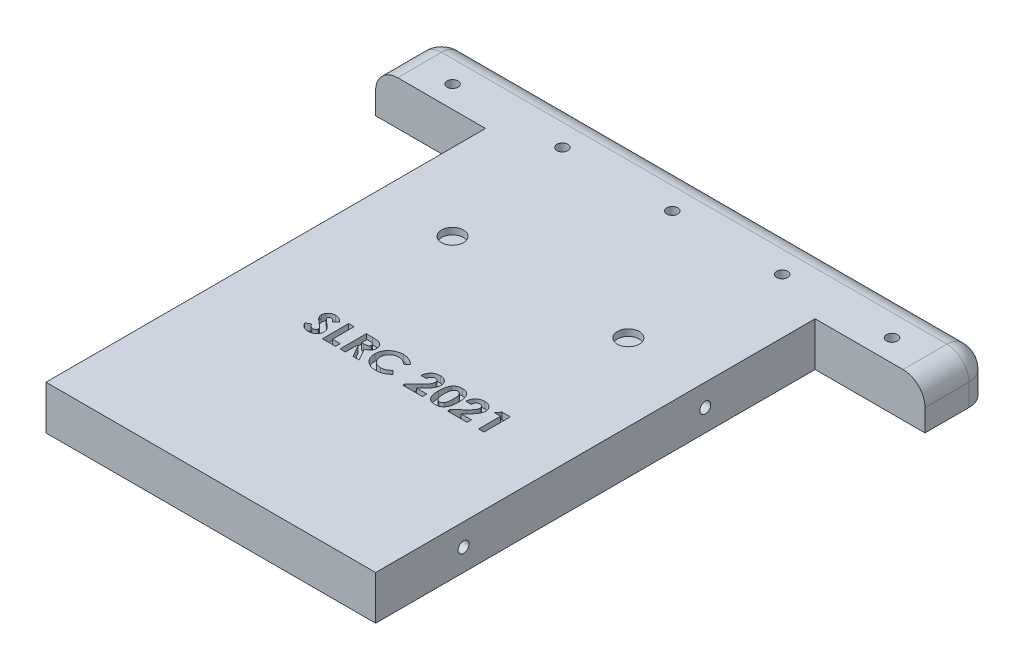
from build123d import *

# Parameters (mm, degrees)
BOSS_EXTRUDE1_DEPTH = 20
SKETCH2_R           = 2.5
CUT_EXTRUDE1_DEPTH  = 240.374184072
SKETCH4_R           = 2.5
CUT_EXTRUDE2_DEPTH  = 5
FILLET1_R           = 10
FILLET2_R           = 10
SKETCH6_R           = 2.5
CUT_EXTRUDE3_DEPTH  = 5
CUT_EXTRUDE4_DEPTH  = 3
SKETCH8_R           = 5
CUT_EXTRUDE5_DEPTH  = 3


with BuildPart() as part:
    # Sketch1 → Boss-Extrude1 (new body)
    with BuildSketch(Plane(origin=(0, 0, 0), x_dir=(1, 0, 0), z_dir=(0, 1, 0))):
        Polygon((-75, -100), (75, -100), (75, 100), (125, 100), (125, 130), (-125, 130), (-125, 100), (-75, 100), align=None)
    extrude(amount=BOSS_EXTRUDE1_DEPTH)

    # Sketch2 → Cut-Extrude1 (cut, through all)
    with BuildSketch(Plane.ZY.offset(75)):
        with Locations((60, 10)):
            Circle(SKETCH2_R)
        with Locations((-50, 10)):
            Circle(SKETCH2_R)
    extrude(amount=-CUT_EXTRUDE1_DEPTH, mode=Mode.SUBTRACT)

    # Sketch4 → Cut-Extrude2 (cut)
    with BuildSketch(Plane.XZ):
        with Locations((-100, -115)):
            Circle(SKETCH4_R)
        with Locations((-50, -115)):
            Circle(SKETCH4_R)
        with Locations((0, -115)):
            Circle(SKETCH4_R)
        with Locations((50, -115)):
            Circle(SKETCH4_R)
        with Locations((100, -115)):
            Circle(SKETCH4_R)
    extrude(amount=-CUT_EXTRUDE2_DEPTH, mode=Mode.SUBTRACT)

    # Fillet1
    fillet1_edges = [part.edges().sort_by_distance(p)[0] for p in [
        (125, 10, -130),
        (-125, 10, -130),
    ]]
    fillet(fillet1_edges, radius=FILLET1_R)

    # Fillet2
    fillet2_edges = [part.edges().sort_by_distance(p)[0] for p in [
        (125, 20, -110),
        (122.071067812, 20, -127.071067812),
        (-125, 20, -110),
        (-122.071067812, 20, -127.071067812),
        (0, 20, -130),
    ]]
    fillet(fillet2_edges, radius=FILLET2_R)

    # Sketch6 → Cut-Extrude3 (cut)
    with BuildSketch(Plane(origin=(0, 20, 0), x_dir=(1, 0, 0), z_dir=(0, 1, 0))):
        with Locations((0, 110)):
            Circle(SKETCH6_R)
        with Locations((50, 110)):
            Circle(SKETCH6_R)
        with Locations((100, 110)):
            Circle(SKETCH6_R)
        with Locations((-50, 110)):
            Circle(SKETCH6_R)
        with Locations((-100, 110)):
            Circle(SKETCH6_R)
    extrude(amount=-CUT_EXTRUDE3_DEPTH, mode=Mode.SUBTRACT)

    # Sketch7 → Cut-Extrude4 (cut)
    # profile 1 of 8: a face of its own
    with BuildSketch(Plane(origin=(0, 20, 0), x_dir=(1, 0, 0), z_dir=(0, 1, 0))):
        with BuildLine():
            Line((-31.846153846, -9.603365385), (-33.569711538, -11.076923077))
            add(Edge.make_bspline(
                [(-33.569711538, -11.076923077), (-33.644422364, -10.979609953), (-33.78789155, -10.792736972), (-34.01705937, -10.542004543), (-34.245532636, -10.327790599), (-34.477112798, -10.152770304), (-34.711094562, -10.016499947), (-34.946137878, -9.919001882), (-35.18275171, -9.857378542), (-35.341793536, -9.849875239), (-35.420673077, -9.846153846)],
                knots=[0, 0, 0, 0, 1.277318712, 2.45286911, 3.533588782, 4.535065184, 5.46981375, 6.345469513, 7.179407024, 8, 8, 8, 8], degree=3))
            add(Edge.make_bspline(
                [(-35.420673077, -9.846153846), (-35.493855999, -9.848461838), (-35.634584407, -9.852900032), (-35.835698076, -9.899857175), (-36.015804003, -9.976974582), (-36.171665287, -10.082497989), (-36.297031003, -10.205970517), (-36.394551355, -10.337918443), (-36.448775689, -10.483270402), (-36.457317273, -10.582950403), (-36.461538462, -10.632211538)],
                knots=[0, 0, 0, 0, 1.217479296, 2.341173553, 3.417477448, 4.465338837, 5.456563799, 6.338062097, 7.178682312, 8, 8, 8, 8], degree=3))
            add(Edge.make_bspline(
                [(-36.461538462, -10.632211538), (-36.458318499, -10.682102228), (-36.451838572, -10.782503391), (-36.412642654, -10.931309097), (-36.343889842, -11.074331497), (-36.281791392, -11.161899965), (-36.25, -11.206730769)],
                knots=[0, 0, 0, 0, 0.961387754, 1.934718672, 2.942676219, 4, 4, 4, 4], degree=3))
            add(Edge.make_bspline(
                [(-36.25, -11.206730769), (-36.219914395, -11.241520871), (-36.150901257, -11.321325617), (-36.02274131, -11.449094182), (-35.860724278, -11.604500294), (-35.659805748, -11.784160695), (-35.425027858, -11.991038349), (-35.151328746, -12.22197615), (-34.843241168, -12.480481228), (-34.62436396, -12.66045476), (-34.509615385, -12.754807692)],
                knots=[0, 0, 0, 0, 0.473340372, 1.085791838, 1.861725834, 2.784458208, 3.859937724, 5.082978446, 6.470722139, 8, 8, 8, 8], degree=3))
            add(Edge.make_bspline(
                [(-34.509615385, -12.754807692), (-34.402394977, -12.842332271), (-34.198522541, -13.008754406), (-33.906803238, -13.242138078), (-33.652917795, -13.455936145), (-33.428229585, -13.638584431), (-33.241454128, -13.801597219), (-33.084255527, -13.935001953), (-32.961867862, -14.045102289), (-32.89251261, -14.111254927), (-32.862980769, -14.139423077)],
                knots=[0, 0, 0, 0, 1.543675599, 2.93519593, 4.166390145, 5.245405028, 6.164324761, 6.931062555, 7.544840672, 8, 8, 8, 8], degree=3))
            add(Edge.make_bspline(
                [(-32.862980769, -14.139423077), (-32.749625482, -14.253808656), (-32.532436068, -14.472972116), (-32.251662058, -14.816355614), (-32.015572919, -15.147223612), (-31.837552187, -15.48034339), (-31.70345273, -15.815238831), (-31.604701748, -16.160260205), (-31.550180404, -16.521486934), (-31.542397014, -16.767457887), (-31.538461538, -16.891826923)],
                knots=[0, 0, 0, 0, 1.227179859, 2.351284024, 3.378339862, 4.321367522, 5.223305034, 6.124621562, 7.051761985, 8, 8, 8, 8], degree=3))
            add(Edge.make_bspline(
                [(-31.538461538, -16.891826923), (-31.541538486, -17.013007029), (-31.547577598, -17.250846724), (-31.599817678, -17.599627803), (-31.682958194, -17.931891249), (-31.801584736, -18.248531465), (-31.957798995, -18.546658422), (-32.141595844, -18.83317225), (-32.366856717, -19.097052268), (-32.617012447, -19.347620647), (-32.897966472, -19.57132288), (-33.199370368, -19.770686474), (-33.523007975, -19.936382483), (-33.867713187, -20.072046957), (-34.232664456, -20.176376715), (-34.617494459, -20.254055681), (-35.022897571, -20.300367501), (-35.300358761, -20.305213234), (-35.442307692, -20.307692308)],
                knots=[0, 0, 0, 0, 0.999766624, 1.962237841, 2.90384921, 3.82270094, 4.745614044, 5.677512525, 6.625951363, 7.603395152, 8.596026376, 9.584772012, 10.581624785, 11.591187941, 12.637768575, 13.710459695, 14.828672936, 16, 16, 16, 16], degree=3))
            add(Edge.make_bspline(
                [(-35.442307692, -20.307692308), (-35.553749087, -20.305889425), (-35.773806717, -20.302329364), (-36.098179467, -20.272803833), (-36.411413977, -20.22521935), (-36.713388102, -20.15760393), (-37.004971769, -20.070949862), (-37.286400014, -19.965509958), (-37.556402797, -19.840152043), (-37.815488009, -19.69517945), (-38.063673194, -19.528551887), (-38.302360306, -19.340502984), (-38.530966761, -19.129688287), (-38.753384006, -18.899034506), (-38.96325178, -18.643521159), (-39.166950672, -18.36847703), (-39.358773094, -18.069606804), (-39.477760347, -17.859559304), (-39.538461538, -17.752403846)],
                knots=[0, 0, 0, 0, 1.047498313, 2.068441419, 3.059231922, 4.024170881, 4.975130488, 5.916735576, 6.846911781, 7.770998236, 8.70488822, 9.654295141, 10.62465836, 11.626271271, 12.664055072, 13.730743618, 14.842341825, 16, 16, 16, 16], degree=3))
            Line((-39.538461538, -17.752403846), (-37.533653846, -16.615384615))
            add(Edge.make_bspline(
                [(-37.533653846, -16.615384615), (-37.458911629, -16.73704294), (-37.315335428, -16.970742726), (-37.073737096, -17.284008747), (-36.826282183, -17.551157732), (-36.570202694, -17.771026098), (-36.303631223, -17.942416859), (-36.027093617, -18.06370819), (-35.742054075, -18.140050265), (-35.548534728, -18.149252217), (-35.451923077, -18.153846154)],
                knots=[0, 0, 0, 0, 1.263139482, 2.426430153, 3.495266246, 4.48153534, 5.406311373, 6.289232501, 7.145924809, 8, 8, 8, 8], degree=3))
            add(Edge.make_bspline(
                [(-35.451923077, -18.153846154), (-35.352954735, -18.150038629), (-35.160754092, -18.142644258), (-34.886211349, -18.075441972), (-34.634584365, -17.969680273), (-34.417309612, -17.818031831), (-34.234335739, -17.642937118), (-34.097732084, -17.448980893), (-34.015433422, -17.236954666), (-34.005160207, -17.09042724), (-34, -17.016826923)],
                knots=[0, 0, 0, 0, 1.163832301, 2.260210803, 3.308505476, 4.360742954, 5.361758128, 6.277907902, 7.134997948, 8, 8, 8, 8], degree=3))
            add(Edge.make_bspline(
                [(-34, -17.016826923), (-34.003610814, -16.948274254), (-34.010968821, -16.808579725), (-34.07610932, -16.601634761), (-34.176083265, -16.395487781), (-34.291299808, -16.225901663), (-34.408544697, -16.082894848), (-34.524918007, -15.962432755), (-34.661201302, -15.824557575), (-34.823616667, -15.675966465), (-35.008737321, -15.513431034), (-35.21509161, -15.333923187), (-35.449009013, -15.14598865), (-35.612168517, -15.01520578), (-35.697115385, -14.947115385)],
                knots=[0, 0, 0, 0, 0.892402583, 1.818510659, 2.804945013, 3.874697065, 4.483648646, 5.215708092, 6.058298861, 7.012472764, 8.086251532, 9.272156419, 10.579783825, 12, 12, 12, 12], degree=3))
            add(Edge.make_bspline(
                [(-35.697115385, -14.947115385), (-35.860326209, -14.817990872), (-36.173033071, -14.570592324), (-36.614227206, -14.203813988), (-37.01122103, -13.860309811), (-37.364522898, -13.540339478), (-37.670417041, -13.240902411), (-37.93428116, -12.968128171), (-38.151504012, -12.716417012), (-38.376621249, -12.416554589), (-38.59380843, -12.05341453), (-38.781019495, -11.614499658), (-38.90257908, -11.175591353), (-38.916323805, -10.880541914), (-38.923076923, -10.735576923)],
                knots=[0, 0, 0, 0, 1.365689936, 2.616619431, 3.764752617, 4.810693309, 5.744036183, 6.573410299, 7.300607496, 7.924251543, 9.032571599, 10.066881874, 11.050211877, 12, 12, 12, 12], degree=3))
            add(Edge.make_bspline(
                [(-38.923076923, -10.735576923), (-38.920865168, -10.632790201), (-38.916502502, -10.430044415), (-38.864940317, -10.132318195), (-38.789473897, -9.844877699), (-38.680267423, -9.569047758), (-38.539147974, -9.305163141), (-38.367905816, -9.051904826), (-38.16436289, -8.810800401), (-37.932442578, -8.583908357), (-37.67728094, -8.377645444), (-37.407209078, -8.191957591), (-37.119302824, -8.038809653), (-36.818768207, -7.910755643), (-36.503294825, -7.811203584), (-36.173155927, -7.742200461), (-35.827975095, -7.700858234), (-35.593062894, -7.69519083), (-35.473557692, -7.692307692)],
                knots=[0, 0, 0, 0, 0.963119029, 1.899742706, 2.825934193, 3.747110609, 4.675130108, 5.627810591, 6.609404785, 7.629881686, 8.666397204, 9.683713782, 10.699279647, 11.719756548, 12.744294213, 13.79681864, 14.879191321, 16, 16, 16, 16], degree=3))
            add(Edge.make_bspline(
                [(-35.473557692, -7.692307692), (-35.318586771, -7.697470824), (-35.010736657, -7.707727399), (-34.55588413, -7.78773844), (-34.11220764, -7.915551887), (-33.752572709, -8.066110361), (-33.467452589, -8.217002966), (-33.246770176, -8.350831913), (-33.023893574, -8.509044709), (-32.793722555, -8.68341605), (-32.564690282, -8.885726608), (-32.325787076, -9.102772869), (-32.085421323, -9.344427624), (-31.927334497, -9.515510837), (-31.846153846, -9.603365385)],
                knots=[0, 0, 0, 0, 1.316312799, 2.614858576, 3.91215405, 5.233669687, 5.919003686, 6.652379443, 7.424978738, 8.240779349, 9.104907034, 10.020538666, 10.983508212, 12, 12, 12, 12], degree=3))
        make_face()
    # profile 2 of 8: a face of its own
    with BuildSketch(Plane(origin=(0, 20, 0), x_dir=(1, 0, 0), z_dir=(0, 1, 0))):
        Polygon((-29.230769231, -8), (-26.769230769, -8), (-26.769230769, -17.846153846), (-23.230769231, -17.846153846), (-23.230769231, -20), (-29.230769231, -20), align=None)
    # profile 3 of 8: a face of its own
    with BuildSketch(Plane(origin=(0, 20, 0), x_dir=(1, 0, 0), z_dir=(0, 1, 0))):
        with BuildLine():
            Line((-21.230769231, -8), (-18.459134615, -8))
            add(Edge.make_bspline(
                [(-18.459134615, -8), (-18.276425421, -8.00060156), (-17.924543573, -8.001760112), (-17.41722597, -8.019498697), (-16.949804449, -8.044705902), (-16.523894748, -8.081942653), (-16.139084959, -8.132796106), (-15.79564858, -8.192022559), (-15.491449561, -8.259790243), (-15.224165066, -8.343004289), (-14.983594726, -8.438946817), (-14.759231317, -8.547030941), (-14.546819088, -8.670759646), (-14.344832858, -8.806598903), (-14.156422343, -8.959261555), (-13.980552163, -9.126445207), (-13.814146977, -9.305733828), (-13.663079033, -9.501000126), (-13.527041159, -9.706955007), (-13.404445715, -9.921752474), (-13.305281015, -10.148232158), (-13.219564641, -10.382123712), (-13.154913532, -10.62596628), (-13.109519957, -10.878402691), (-13.082766349, -11.140449052), (-13.078897092, -11.318047041), (-13.076923077, -11.408653846)],
                knots=[0, 0, 0, 0, 1.810401764, 3.486674673, 5.029519145, 6.448546818, 7.721978868, 8.874627388, 9.901230509, 10.807823259, 11.645301282, 12.465628286, 13.273214053, 14.079237002, 14.87534365, 15.672913984, 16.482098508, 17.29687332, 18.116085201, 18.926632022, 19.744110526, 20.562899031, 21.393004911, 22.24024988, 23.102212043, 24, 24, 24, 24], degree=3))
            add(Edge.make_bspline(
                [(-13.076923077, -11.408653846), (-13.078753506, -11.503271653), (-13.082345646, -11.688955211), (-13.111068304, -11.9616758), (-13.161842425, -12.222035657), (-13.231991268, -12.471194891), (-13.320050442, -12.708968059), (-13.429606686, -12.935070918), (-13.558742528, -13.148720237), (-13.710117505, -13.349318812), (-13.877366045, -13.539869833), (-14.067786028, -13.716165796), (-14.275843936, -13.882281858), (-14.506702371, -14.033003399), (-14.754603453, -14.176180694), (-15.024375189, -14.30475269), (-15.313119495, -14.423400629), (-15.514777822, -14.490012129), (-15.617788462, -14.524038462)],
                knots=[0, 0, 0, 0, 1.043198031, 2.047233251, 3.01934853, 3.964797548, 4.898614941, 5.811463997, 6.731256592, 7.646625036, 8.579229433, 9.523149634, 10.504257845, 11.511437172, 12.560232801, 13.658834121, 14.804091076, 16, 16, 16, 16], degree=3))
            Line((-15.617788462, -14.524038462), (-12.538461538, -20))
            Line((-12.538461538, -20), (-15.3125, -20))
            Line((-15.3125, -20), (-18.254807692, -14.769230769))
            Line((-18.254807692, -14.769230769), (-18.769230769, -14.769230769))
            Line((-18.769230769, -14.769230769), (-18.769230769, -20))
            Line((-18.769230769, -20), (-21.230769231, -20))
            Line((-21.230769231, -20), (-21.230769231, -8))
        make_face()
        with BuildLine():
            Line((-18.769230769, -12.615384615), (-17.889423077, -12.615384615))
            add(Edge.make_bspline(
                [(-17.889423077, -12.615384615), (-17.782047244, -12.614231026), (-17.576039597, -12.612017789), (-17.279204189, -12.601682709), (-17.009038137, -12.577162471), (-16.764573087, -12.545592604), (-16.54600261, -12.510271252), (-16.354740689, -12.457958837), (-16.187877142, -12.402464016), (-16.0457543, -12.334476128), (-15.924949043, -12.255599955), (-15.820238387, -12.166895229), (-15.733249548, -12.063851559), (-15.659161287, -11.951103694), (-15.607953821, -11.82279761), (-15.566077998, -11.68651309), (-15.541618966, -11.536919682), (-15.539542229, -11.433582283), (-15.538461538, -11.379807692)],
                knots=[0, 0, 0, 0, 1.708363675, 3.277608857, 4.723712974, 6.021838054, 7.199660436, 8.241690857, 9.172961181, 9.993967569, 10.739999558, 11.46313589, 12.168296226, 12.87908003, 13.598837728, 14.357076655, 15.145057537, 16, 16, 16, 16], degree=3))
            add(Edge.make_bspline(
                [(-15.538461538, -11.379807692), (-15.540668544, -11.316145446), (-15.545010896, -11.19088801), (-15.596211281, -11.011455346), (-15.673368734, -10.843244553), (-15.785869245, -10.693492748), (-15.921042029, -10.55720041), (-16.080721278, -10.442272476), (-16.261047687, -10.347518656), (-16.428552686, -10.287208394), (-16.581751579, -10.249629298), (-16.719715136, -10.223553644), (-16.88033509, -10.20278883), (-17.061397254, -10.183319491), (-17.265060158, -10.169265485), (-17.490301252, -10.159847233), (-17.737966693, -10.155771223), (-17.910255791, -10.154505474), (-18, -10.153846154)],
                knots=[0, 0, 0, 0, 0.985252127, 1.938513972, 2.873098658, 3.843165384, 4.828025027, 5.842890392, 6.883115312, 7.980634618, 8.595920604, 9.330050158, 10.158404267, 11.108741491, 12.156004298, 13.326020887, 14.60714262, 16, 16, 16, 16], degree=3))
            Line((-18, -10.153846154), (-18.769230769, -10.153846154))
            Line((-18.769230769, -10.153846154), (-18.769230769, -12.615384615))
        make_face(mode=Mode.SUBTRACT)
    # profile 4 of 8: a face of its own
    with BuildSketch(Plane(origin=(0, 20, 0), x_dir=(1, 0, 0), z_dir=(0, 1, 0))):
        with BuildLine():
            Line((0.923076923, -10.081730769), (-0.762019231, -11.591346154))
            add(Edge.make_bspline(
                [(-0.762019231, -11.591346154), (-0.904754062, -11.452603787), (-1.184570047, -11.180614592), (-1.635215137, -10.823272045), (-2.102493257, -10.524978587), (-2.578855785, -10.273011322), (-3.072699671, -10.083681183), (-3.578014652, -9.945115074), (-4.098108895, -9.860567079), (-4.450009675, -9.850984468), (-4.627403846, -9.846153846)],
                knots=[0, 0, 0, 0, 1.095275014, 2.147166567, 3.159011481, 4.143451472, 5.108369974, 6.063897442, 7.024005268, 8, 8, 8, 8], degree=3))
            add(Edge.make_bspline(
                [(-4.627403846, -9.846153846), (-4.77580636, -9.849930679), (-5.067254013, -9.857347999), (-5.495652899, -9.913407382), (-5.905787541, -10.00782276), (-6.299643284, -10.13663106), (-6.67391159, -10.307221222), (-7.031908822, -10.511246751), (-7.36924773, -10.756767371), (-7.686508353, -11.033201437), (-7.976444819, -11.336550185), (-8.230400595, -11.661343344), (-8.442366057, -12.005853136), (-8.620315086, -12.364523834), (-8.754354484, -12.743560855), (-8.853869889, -13.138385619), (-8.912276736, -13.55194045), (-8.919439409, -13.833150777), (-8.923076923, -13.975961538)],
                knots=[0, 0, 0, 0, 1.07163633, 2.104586266, 3.113971069, 4.107706065, 5.091958964, 6.079676596, 7.078722486, 8.100048012, 9.115206305, 10.104973269, 11.071768225, 12.031993481, 12.991206705, 13.969520858, 14.968834903, 16, 16, 16, 16], degree=3))
            add(Edge.make_bspline(
                [(-8.923076923, -13.975961538), (-8.920840325, -14.076158602), (-8.91643243, -14.273627298), (-8.893138948, -14.566090633), (-8.849441192, -14.849423578), (-8.789368908, -15.124031026), (-8.712911497, -15.390429696), (-8.614997022, -15.647003078), (-8.506186985, -15.898400585), (-8.375510058, -16.137563475), (-8.231356962, -16.366669062), (-8.07228465, -16.583557854), (-7.898689729, -16.78827351), (-7.711486171, -16.981085339), (-7.508232694, -17.159372493), (-7.291659797, -17.324783095), (-7.062012148, -17.480110996), (-6.818744642, -17.620944659), (-6.563244271, -17.744860128), (-6.30190742, -17.856977223), (-6.032132077, -17.947390068), (-5.755878849, -18.022027462), (-5.473753277, -18.083247397), (-5.182699481, -18.122277275), (-4.885996046, -18.15110003), (-4.685168938, -18.152927014), (-4.584134615, -18.153846154)],
                knots=[0, 0, 0, 0, 1.068669081, 2.106136483, 3.126107755, 4.123384019, 5.102297023, 6.078408911, 7.050134936, 8.021259646, 8.981382218, 9.935056973, 10.886930785, 11.841676827, 12.798256569, 13.767311411, 14.746112523, 15.75300693, 16.761893576, 17.772840762, 18.783462879, 19.792964512, 20.823653315, 21.859289228, 22.923027544, 24, 24, 24, 24], degree=3))
            add(Edge.make_bspline(
                [(-4.584134615, -18.153846154), (-4.413229602, -18.149169945), (-4.077177183, -18.139975065), (-3.583956154, -18.069110209), (-3.113649302, -17.951165222), (-2.737247338, -17.814077566), (-2.443321777, -17.675635507), (-2.219080942, -17.549764434), (-1.987391834, -17.408102435), (-1.751940826, -17.246290159), (-1.51040637, -17.065211079), (-1.264726407, -16.863226841), (-1.011118904, -16.644792183), (-0.844779533, -16.488615035), (-0.759615385, -16.408653846)],
                knots=[0, 0, 0, 0, 1.421922702, 2.795942337, 4.136695013, 5.451036477, 6.122191754, 6.838535035, 7.589930979, 8.381556912, 9.21510047, 10.101388957, 11.027929521, 12, 12, 12, 12], degree=3))
            Line((-0.759615385, -16.408653846), (0.872596154, -18.016826923))
            add(Edge.make_bspline(
                [(0.872596154, -18.016826923), (0.757204918, -18.121104052), (0.53074487, -18.325752207), (0.185221227, -18.610381737), (-0.155524814, -18.871799574), (-0.490242708, -19.109059541), (-0.819940562, -19.322186938), (-1.146567411, -19.507543044), (-1.466570835, -19.67155472), (-1.786445297, -19.810306986), (-2.108286202, -19.929092823), (-2.438577448, -20.029187873), (-2.778984012, -20.117422791), (-3.131741355, -20.185215442), (-3.494806348, -20.241696534), (-3.868795132, -20.278780707), (-4.253646325, -20.30441124), (-4.514378938, -20.306588102), (-4.646634615, -20.307692308)],
                knots=[0, 0, 0, 0, 1.21505803, 2.384601358, 3.496557184, 4.570060326, 5.589476934, 6.562485805, 7.50325749, 8.397682164, 9.285067479, 10.18218321, 11.09325896, 12.03131858, 12.987586614, 13.963150137, 14.966815254, 16, 16, 16, 16], degree=3))
            add(Edge.make_bspline(
                [(-4.646634615, -20.307692308), (-4.888045749, -20.301955879), (-5.361065218, -20.290715956), (-6.054707025, -20.208267161), (-6.714623289, -20.06963779), (-7.341051407, -19.874365499), (-7.933243719, -19.62372801), (-8.491691741, -19.31609605), (-9.017875324, -18.955100349), (-9.503582506, -18.539360309), (-9.944829867, -18.083441691), (-10.330401973, -17.589650463), (-10.655429519, -17.063466728), (-10.924795327, -16.50751021), (-11.132396804, -15.91964399), (-11.277458158, -15.300546578), (-11.369605432, -14.651008498), (-11.379547898, -14.207047663), (-11.384615385, -13.980769231)],
                knots=[0, 0, 0, 0, 1.117465895, 2.189555701, 3.228498692, 4.235165414, 5.222502082, 6.200378742, 7.182005487, 8.171409688, 9.155227872, 10.114686485, 11.065876977, 12.013240484, 12.969452238, 13.945688111, 14.952956121, 16, 16, 16, 16], degree=3))
            add(Edge.make_bspline(
                [(-11.384615385, -13.980769231), (-11.38141585, -13.833267782), (-11.375075666, -13.540979462), (-11.337644556, -13.109420835), (-11.269008738, -12.690476003), (-11.176049832, -12.284682179), (-11.055380979, -11.889970303), (-10.906421175, -11.509632078), (-10.732347202, -11.140357276), (-10.530039606, -10.786150044), (-10.305309142, -10.444316413), (-10.052869915, -10.121128029), (-9.77979328, -9.813649685), (-9.482439711, -9.523787506), (-9.162040063, -9.252526069), (-8.819653735, -8.996615681), (-8.453289385, -8.75853375), (-8.066063504, -8.539243033), (-7.663751264, -8.339650772), (-7.250048505, -8.166767983), (-6.828592649, -8.019991933), (-6.400276024, -7.898520788), (-5.963641509, -7.808832918), (-5.521055063, -7.73977572), (-5.069574737, -7.701798057), (-4.766089741, -7.695490082), (-4.612980769, -7.692307692)],
                knots=[0, 0, 0, 0, 1.030034998, 2.041113499, 3.021651664, 3.992064955, 4.945999175, 5.900851806, 6.841884049, 7.794028106, 8.746829494, 9.695877997, 10.65490156, 11.616353881, 12.592813018, 13.584257058, 14.599182945, 15.641544, 16.689968957, 17.733230592, 18.770141552, 19.80460422, 20.839384586, 21.880724042, 22.930819749, 24, 24, 24, 24], degree=3))
            add(Edge.make_bspline(
                [(-4.612980769, -7.692307692), (-4.482313896, -7.694109036), (-4.222264377, -7.69769402), (-3.834023468, -7.728029263), (-3.449337053, -7.774534077), (-3.069686594, -7.846291891), (-2.692609598, -7.931169767), (-2.320632295, -8.041610566), (-1.949495826, -8.164532285), (-1.585522259, -8.312570016), (-1.22776311, -8.474515331), (-0.882455915, -8.655192567), (-0.548198618, -8.849753573), (-0.229603035, -9.064803988), (0.079372857, -9.293031915), (0.375031534, -9.538209701), (0.657592272, -9.800679462), (0.834336414, -9.987786973), (0.923076923, -10.081730769)],
                knots=[0, 0, 0, 0, 1.010866788, 2.011798525, 3.011481439, 4.007408487, 4.99999151, 6.000635196, 7.008360124, 8.023779535, 9.039198945, 10.045798041, 11.037858147, 12.03001511, 13.018270933, 14.008935245, 15.000317086, 16, 16, 16, 16], degree=3))
        make_face()
    # profile 5 of 8: a face of its own
    with BuildSketch(Plane(origin=(0, 20, 0), x_dir=(1, 0, 0), z_dir=(0, 1, 0))):
        with BuildLine():
            Line((10.153846154, -12), (7.692307692, -12))
            add(Edge.make_bspline(
                [(7.692307692, -12), (7.703071364, -11.837029833), (7.724119879, -11.518339318), (7.803196416, -11.055466251), (7.912150846, -10.617992636), (8.059153324, -10.208300285), (8.240544446, -9.824674917), (8.456977565, -9.468366658), (8.708813145, -9.138366787), (8.994922237, -8.8395308), (9.307794161, -8.569418239), (9.644082528, -8.33362949), (10.003287522, -8.13413857), (10.384594992, -7.974694137), (10.785215936, -7.844662198), (11.208657248, -7.758556261), (11.652204722, -7.700010343), (11.955729604, -7.694909802), (12.110576923, -7.692307692)],
                knots=[0, 0, 0, 0, 1.134633983, 2.218793145, 3.258980965, 4.264964422, 5.239112198, 6.203899951, 7.157497069, 8.118773505, 9.074515365, 10.026354099, 10.968759373, 11.924647291, 12.895221723, 13.891490395, 14.924315338, 16, 16, 16, 16], degree=3))
            add(Edge.make_bspline(
                [(12.110576923, -7.692307692), (12.300815217, -7.697565715), (12.671348237, -7.707806929), (13.210059221, -7.795698729), (13.713843859, -7.942712581), (14.182505253, -8.14667736), (14.610245501, -8.408271579), (14.996877014, -8.720165136), (15.335678001, -9.087009175), (15.622341194, -9.497940546), (15.857562165, -9.933095669), (16.02758566, -10.381462959), (16.134047784, -10.834771386), (16.147283112, -11.139672936), (16.153846154, -11.290865385)],
                knots=[0, 0, 0, 0, 1.136945024, 2.214463054, 3.252982776, 4.267757423, 5.261179961, 6.242150873, 7.228710145, 8.236265821, 9.230843018, 10.178524313, 11.096779378, 12, 12, 12, 12], degree=3))
            add(Edge.make_bspline(
                [(16.153846154, -11.290865385), (16.152206808, -11.382309981), (16.148904227, -11.566531756), (16.114872004, -11.845011115), (16.065416711, -12.128738412), (15.992554593, -12.417765995), (15.898023049, -12.711076359), (15.784010161, -13.00995297), (15.652874812, -13.314916488), (15.497033735, -13.625419884), (15.314581429, -13.945816404), (15.101288128, -14.2800391), (14.848983272, -14.62475689), (14.567116261, -14.987251066), (14.250131587, -15.362371424), (13.900463167, -15.753345022), (13.515655563, -16.15658939), (13.243466279, -16.426153947), (13.103365385, -16.564903846)],
                knots=[0, 0, 0, 0, 0.70173144, 1.413688917, 2.151001631, 2.911931484, 3.699860375, 4.515634815, 5.36702502, 6.247392281, 7.181345131, 8.196701277, 9.289429988, 10.459703025, 11.721532442, 13.059011883, 14.486218638, 16, 16, 16, 16], degree=3))
            Line((13.103365385, -16.564903846), (11.653846154, -18))
            Line((11.653846154, -18), (16.307692308, -18))
            Line((16.307692308, -18), (16.307692308, -20))
            Line((16.307692308, -20), (7.384615385, -20))
            Line((7.384615385, -20), (7.384615385, -18.908653846))
            Line((7.384615385, -18.908653846), (11.322115385, -15.127403846))
            add(Edge.make_bspline(
                [(11.322115385, -15.127403846), (11.436341494, -15.017277461), (11.657032573, -14.804507274), (11.969270142, -14.489234079), (12.254331601, -14.192235965), (12.505660627, -13.90894637), (12.72811192, -13.643913196), (12.921714634, -13.396181517), (13.085134101, -13.164606698), (13.25856306, -12.883730763), (13.429462625, -12.552006887), (13.577595132, -12.165256941), (13.674209626, -11.797984783), (13.686450985, -11.55740819), (13.692307692, -11.442307692)],
                knots=[0, 0, 0, 0, 1.271671112, 2.456938016, 3.556250781, 4.570661973, 5.491623013, 6.32920408, 7.08999045, 7.761906759, 8.973995503, 10.07370215, 11.078389805, 12, 12, 12, 12], degree=3))
            add(Edge.make_bspline(
                [(13.692307692, -11.442307692), (13.687694727, -11.330971503), (13.678730958, -11.114626551), (13.581674508, -10.807404206), (13.431386478, -10.528457098), (13.217133996, -10.290010854), (12.959932675, -10.090886442), (12.661109055, -9.947614605), (12.327649239, -9.861707795), (12.094275043, -9.851456519), (11.973557692, -9.846153846)],
                knots=[0, 0, 0, 0, 1.014337146, 1.971027763, 2.91485283, 3.890276386, 4.877421019, 5.869766603, 6.898095268, 8, 8, 8, 8], degree=3))
            add(Edge.make_bspline(
                [(11.973557692, -9.846153846), (11.910968889, -9.848120921), (11.788427298, -9.851972226), (11.607730606, -9.878869693), (11.435507323, -9.924689987), (11.270230325, -9.98666713), (11.114609948, -10.070633997), (10.965993962, -10.170846275), (10.826092966, -10.290397811), (10.693311259, -10.424191417), (10.574426157, -10.575683414), (10.466949576, -10.739575773), (10.378852339, -10.918712943), (10.304313034, -11.110391388), (10.241254965, -11.314034799), (10.195893677, -11.531329789), (10.167788635, -11.7613992), (10.158579158, -11.91900304), (10.153846154, -12)],
                knots=[0, 0, 0, 0, 0.954761899, 1.86931266, 2.779605103, 3.669560204, 4.555476154, 5.470925175, 6.39910007, 7.358623903, 8.341839451, 9.331946339, 10.343332224, 11.38075725, 12.467360984, 13.591813212, 14.76236639, 16, 16, 16, 16], degree=3))
        make_face()
    # profile 6 of 8: a face of its own
    with BuildSketch(Plane(origin=(0, 20, 0), x_dir=(1, 0, 0), z_dir=(0, 1, 0))):
        with BuildLine():
            add(Edge.make_bspline(
                [(22.192307692, -7.692307692), (22.307765901, -7.693912595), (22.535914579, -7.697083927), (22.871500123, -7.729443305), (23.195749154, -7.780117262), (23.508060086, -7.848277468), (23.807172588, -7.94103185), (24.094771855, -8.050873972), (24.36898505, -8.184116415), (24.631380432, -8.335208507), (24.881436552, -8.50697673), (25.11600244, -8.701190677), (25.336076989, -8.917554816), (25.54350481, -9.152472709), (25.733460547, -9.411560825), (25.908523425, -9.690784071), (26.070625099, -9.990742573), (26.218104259, -10.313918969), (26.34716084, -10.665467356), (26.464770892, -11.045672851), (26.554595932, -11.460575509), (26.636178429, -11.905910268), (26.693061402, -12.385386551), (26.74100022, -12.896579472), (26.762427869, -13.440525808), (26.766921883, -13.813291944), (26.769230769, -14.004807692)],
                knots=[0, 0, 0, 0, 0.93563016, 1.848831593, 2.729774448, 3.594868412, 4.437208033, 5.265839488, 6.087928879, 6.905619219, 7.718134251, 8.54390993, 9.370630127, 10.217464922, 11.081314549, 11.971498649, 12.88691469, 13.843169918, 14.848122052, 15.920630881, 17.066115696, 18.286643536, 19.589293279, 20.978205611, 22.447495204, 24, 24, 24, 24], degree=3))
            add(Edge.make_bspline(
                [(26.769230769, -14.004807692), (26.767335606, -14.198751962), (26.763653083, -14.575608135), (26.736675262, -15.123989652), (26.694941147, -15.639829796), (26.632392043, -16.121795294), (26.554291613, -16.571506659), (26.455353293, -16.987827497), (26.341732477, -17.372213655), (26.208505423, -17.724716657), (26.057852431, -18.046521664), (25.899317772, -18.347826474), (25.726533848, -18.625097917), (25.543692109, -18.882806904), (25.345750263, -19.11583631), (25.137284393, -19.328718928), (24.913712195, -19.516508073), (24.680474361, -19.686770282), (24.430896656, -19.832969832), (24.168163424, -19.962337502), (23.88766564, -20.065882651), (23.593910949, -20.157184245), (23.282070067, -20.222122814), (22.95578057, -20.273857888), (22.613483952, -20.302193055), (22.380655996, -20.305836037), (22.262019231, -20.307692308)],
                knots=[0, 0, 0, 0, 1.580511058, 3.071115994, 4.47350179, 5.796996513, 7.030571928, 8.191579636, 9.282407157, 10.29510619, 11.259270612, 12.176564307, 13.068114522, 13.919841772, 14.749273075, 15.557350541, 16.344984624, 17.126122141, 17.90783265, 18.699301365, 19.509460591, 20.341970905, 21.20397484, 22.102599733, 23.033185556, 24, 24, 24, 24], degree=3))
            add(Edge.make_bspline(
                [(22.262019231, -20.307692308), (22.142577413, -20.305870708), (21.908940547, -20.302307526), (21.565098819, -20.273619999), (21.237104311, -20.22233901), (20.921681704, -20.156121846), (20.621997977, -20.067285638), (20.336237069, -19.95809019), (20.064794342, -19.831565429), (19.807761741, -19.684272203), (19.567029612, -19.514387944), (19.33733114, -19.326355009), (19.121163341, -19.117919474), (18.921347151, -18.887199297), (18.732864233, -18.63864626), (18.55707799, -18.369113276), (18.396819304, -18.077730945), (18.248337264, -17.76451344), (18.115053245, -17.42466165), (18.003874092, -17.050950551), (17.903618124, -16.645661855), (17.830327034, -16.204003033), (17.76608324, -15.730475685), (17.72497484, -15.22253522), (17.69784545, -14.681387029), (17.694189738, -14.309331316), (17.692307692, -14.117788462)],
                knots=[0, 0, 0, 0, 0.979025752, 1.915045443, 2.825409474, 3.698866739, 4.555114038, 5.384617374, 6.204416135, 7.007708529, 7.809468818, 8.61683261, 9.439022341, 10.267615006, 11.116245444, 11.994357896, 12.902824345, 13.840087672, 14.83417843, 15.891752491, 17.033990644, 18.254223638, 19.559394829, 20.95033491, 22.429962141, 24, 24, 24, 24], degree=3))
            add(Edge.make_bspline(
                [(17.692307692, -14.117788462), (17.694966595, -13.851653447), (17.700097926, -13.338048057), (17.755258729, -12.596087823), (17.835956929, -11.910086706), (17.954630309, -11.280572162), (18.111305223, -10.708643025), (18.296671307, -10.191447289), (18.517980187, -9.728943805), (18.701878003, -9.456401371), (18.790865385, -9.324519231)],
                knots=[0, 0, 0, 0, 1.27896107, 2.468225759, 3.574131368, 4.597635645, 5.544133486, 6.421382147, 7.236113441, 8, 8, 8, 8], degree=3))
            add(Edge.make_bspline(
                [(18.790865385, -9.324519231), (18.894335269, -9.19433021), (19.098083432, -8.937967946), (19.453407444, -8.606133545), (19.834631979, -8.32042504), (20.250247291, -8.092361269), (20.692213589, -7.909729353), (21.16557716, -7.782624681), (21.669077074, -7.707777149), (22.014965154, -7.697550873), (22.192307692, -7.692307692)],
                knots=[0, 0, 0, 0, 1.016244352, 2.001141879, 2.964986597, 3.923994093, 4.893569483, 5.884233595, 6.915211574, 8, 8, 8, 8], degree=3))
        make_face()
        with BuildLine():
            add(Edge.make_bspline(
                [(22.247596154, -9.846153846), (22.146183326, -9.850657454), (21.947277014, -9.859490618), (21.658371727, -9.933070414), (21.385797683, -10.048041799), (21.177329108, -10.186381875), (21.020271457, -10.318106648), (20.912349969, -10.438855772), (20.808044186, -10.572427921), (20.715248752, -10.72630939), (20.626417447, -10.893786846), (20.54391271, -11.078271511), (20.470242563, -11.28014027), (20.402998008, -11.500006103), (20.341304111, -11.74102537), (20.29294259, -12.007178339), (20.249599908, -12.298985571), (20.213313466, -12.616404213), (20.188075416, -12.960475946), (20.168955974, -13.33075702), (20.15692241, -13.727486959), (20.154893258, -14.000792775), (20.153846154, -14.141826923)],
                knots=[0, 0, 0, 0, 1.135665613, 2.22744069, 3.322280119, 4.438732227, 5.018593297, 5.616346835, 6.250726176, 6.916463065, 7.627865889, 8.375941898, 9.180435125, 10.035896399, 10.953331412, 11.968354264, 13.067498814, 14.261147438, 15.549793337, 16.935343887, 18.418543841, 20, 20, 20, 20], degree=3))
            add(Edge.make_bspline(
                [(20.153846154, -14.141826923), (20.155750384, -14.324552068), (20.159402304, -14.674981286), (20.185310862, -15.178693384), (20.229440877, -15.637807715), (20.294547449, -16.053419198), (20.374419042, -16.425707423), (20.472051037, -16.755252133), (20.587624059, -17.041324667), (20.727666478, -17.283240556), (20.880449666, -17.488795855), (21.042443182, -17.666946037), (21.216630196, -17.817298086), (21.401963678, -17.941022848), (21.598953926, -18.03545945), (21.805689911, -18.103459529), (22.023165428, -18.145304803), (22.172091232, -18.150972599), (22.247596154, -18.153846154)],
                knots=[0, 0, 0, 0, 1.734480298, 3.326376217, 4.78633064, 6.110617772, 7.317609199, 8.398037611, 9.369876545, 10.238782863, 11.043531687, 11.797198189, 12.519907208, 13.222400553, 13.906197445, 14.586899161, 15.283562243, 16, 16, 16, 16], degree=3))
            add(Edge.make_bspline(
                [(22.247596154, -18.153846154), (22.320699347, -18.151884816), (22.463180291, -18.148062092), (22.671000133, -18.107893157), (22.867518745, -18.042722941), (23.052784222, -17.951291022), (23.226161097, -17.833480828), (23.387776626, -17.690706617), (23.537494072, -17.521585265), (23.623967945, -17.394456201), (23.668269231, -17.329326923)],
                knots=[0, 0, 0, 0, 1.018870827, 1.985818541, 2.940342707, 3.900285342, 4.858403485, 5.856453544, 6.901843296, 8, 8, 8, 8], degree=3))
            add(Edge.make_bspline(
                [(23.668269231, -17.329326923), (23.720041504, -17.240647019), (23.82837065, -17.055091749), (23.955698125, -16.740831316), (24.065314767, -16.386834658), (24.156368293, -15.990783088), (24.22499127, -15.55296526), (24.270416655, -15.073655183), (24.303689489, -14.553346956), (24.306323641, -14.192367354), (24.307692308, -14.004807692)],
                knots=[0, 0, 0, 0, 0.718704599, 1.503829162, 2.368579135, 3.31370004, 4.348373373, 5.471226288, 6.686086587, 8, 8, 8, 8], degree=3))
            add(Edge.make_bspline(
                [(24.307692308, -14.004807692), (24.305733441, -13.815678155), (24.30196307, -13.45164707), (24.276626255, -12.928664554), (24.231222814, -12.451428871), (24.16969375, -12.020404149), (24.092109977, -11.63433277), (23.994793209, -11.293553887), (23.877872976, -10.998356558), (23.742711255, -10.74657585), (23.589715739, -10.535582626), (23.432196739, -10.350132907), (23.259700676, -10.195792805), (23.079171862, -10.06658944), (22.88681959, -9.966236339), (22.683406785, -9.896554401), (22.468864106, -9.85457828), (22.322305131, -9.848998274), (22.247596154, -9.846153846)],
                knots=[0, 0, 0, 0, 1.757656708, 3.383086993, 4.864292323, 6.211226642, 7.42776507, 8.521228347, 9.50025468, 10.373290481, 11.168826028, 11.918387529, 12.630193282, 13.314067891, 13.976859651, 14.638604776, 15.306023774, 16, 16, 16, 16], degree=3))
        make_face(mode=Mode.SUBTRACT)
    # profile 7 of 8: a face of its own
    with BuildSketch(Plane(origin=(0, 20, 0), x_dir=(1, 0, 0), z_dir=(0, 1, 0))):
        with BuildLine():
            Line((30.461538462, -12), (28, -12))
            add(Edge.make_bspline(
                [(28, -12), (28.010763672, -11.837029833), (28.031812187, -11.518339318), (28.110888724, -11.055466251), (28.219843153, -10.617992636), (28.366845631, -10.208300285), (28.548236754, -9.824674917), (28.764669873, -9.468366658), (29.016505452, -9.138366787), (29.302614545, -8.8395308), (29.615486468, -8.569418239), (29.951774836, -8.33362949), (30.31097983, -8.13413857), (30.692287299, -7.974694137), (31.092908244, -7.844662198), (31.516349555, -7.758556261), (31.95989703, -7.700010343), (32.263421912, -7.694909802), (32.418269231, -7.692307692)],
                knots=[0, 0, 0, 0, 1.134633983, 2.218793145, 3.258980965, 4.264964422, 5.239112198, 6.203899951, 7.157497069, 8.118773505, 9.074515365, 10.026354099, 10.968759373, 11.924647291, 12.895221723, 13.891490395, 14.924315338, 16, 16, 16, 16], degree=3))
            add(Edge.make_bspline(
                [(32.418269231, -7.692307692), (32.608507525, -7.697565715), (32.979040545, -7.707806929), (33.517751529, -7.795698729), (34.021536167, -7.942712581), (34.490197561, -8.14667736), (34.917937809, -8.408271579), (35.304569322, -8.720165136), (35.643370309, -9.087009175), (35.930033502, -9.497940546), (36.165254473, -9.933095669), (36.335277967, -10.381462959), (36.441740092, -10.834771386), (36.45497542, -11.139672936), (36.461538462, -11.290865385)],
                knots=[0, 0, 0, 0, 1.136945024, 2.214463054, 3.252982776, 4.267757423, 5.261179961, 6.242150873, 7.228710145, 8.236265821, 9.230843018, 10.178524313, 11.096779378, 12, 12, 12, 12], degree=3))
            add(Edge.make_bspline(
                [(36.461538462, -11.290865385), (36.459899116, -11.382309981), (36.456596535, -11.566531756), (36.422564312, -11.845011115), (36.373109018, -12.128738412), (36.3002469, -12.417765995), (36.205715357, -12.711076359), (36.091702469, -13.00995297), (35.96056712, -13.314916488), (35.804726042, -13.625419884), (35.622273737, -13.945816404), (35.408980436, -14.2800391), (35.15667558, -14.62475689), (34.874808569, -14.987251066), (34.557823895, -15.362371424), (34.208155474, -15.753345022), (33.823347871, -16.15658939), (33.551158587, -16.426153947), (33.411057692, -16.564903846)],
                knots=[0, 0, 0, 0, 0.70173144, 1.413688917, 2.151001631, 2.911931484, 3.699860375, 4.515634815, 5.36702502, 6.247392281, 7.181345131, 8.196701277, 9.289429988, 10.459703025, 11.721532442, 13.059011883, 14.486218638, 16, 16, 16, 16], degree=3))
            Line((33.411057692, -16.564903846), (31.961538462, -18))
            Line((31.961538462, -18), (36.615384615, -18))
            Line((36.615384615, -18), (36.615384615, -20))
            Line((36.615384615, -20), (27.692307692, -20))
            Line((27.692307692, -20), (27.692307692, -18.908653846))
            Line((27.692307692, -18.908653846), (31.629807692, -15.127403846))
            add(Edge.make_bspline(
                [(31.629807692, -15.127403846), (31.744033802, -15.017277461), (31.964724881, -14.804507274), (32.276962449, -14.489234079), (32.562023909, -14.192235965), (32.813352934, -13.90894637), (33.035804227, -13.643913196), (33.229406941, -13.396181517), (33.392826408, -13.164606698), (33.566255367, -12.883730763), (33.737154933, -12.552006887), (33.88528744, -12.165256941), (33.981901933, -11.797984783), (33.994143293, -11.55740819), (34, -11.442307692)],
                knots=[0, 0, 0, 0, 1.271671112, 2.456938016, 3.556250781, 4.570661973, 5.491623013, 6.32920408, 7.08999045, 7.761906759, 8.973995503, 10.07370215, 11.078389805, 12, 12, 12, 12], degree=3))
            add(Edge.make_bspline(
                [(34, -11.442307692), (33.995387034, -11.330971503), (33.986423266, -11.114626551), (33.889366815, -10.807404206), (33.739078786, -10.528457098), (33.524826304, -10.290010854), (33.267624983, -10.090886442), (32.968801363, -9.947614605), (32.635341547, -9.861707795), (32.401967351, -9.851456519), (32.28125, -9.846153846)],
                knots=[0, 0, 0, 0, 1.014337146, 1.971027763, 2.91485283, 3.890276386, 4.877421019, 5.869766603, 6.898095268, 8, 8, 8, 8], degree=3))
            add(Edge.make_bspline(
                [(32.28125, -9.846153846), (32.218661197, -9.848120921), (32.096119605, -9.851972226), (31.915422914, -9.878869693), (31.74319963, -9.924689987), (31.577922632, -9.98666713), (31.422302255, -10.070633997), (31.27368627, -10.170846275), (31.133785273, -10.290397811), (31.001003567, -10.424191417), (30.882118465, -10.575683414), (30.774641884, -10.739575773), (30.686544646, -10.918712943), (30.612005341, -11.110391388), (30.548947273, -11.314034799), (30.503585985, -11.531329789), (30.475480943, -11.7613992), (30.466271466, -11.91900304), (30.461538462, -12)],
                knots=[0, 0, 0, 0, 0.954761899, 1.86931266, 2.779605103, 3.669560204, 4.555476154, 5.470925175, 6.39910007, 7.358623903, 8.341839451, 9.331946339, 10.343332224, 11.38075725, 12.467360984, 13.591813212, 14.76236639, 16, 16, 16, 16], degree=3))
        make_face()
    # profile 8 of 8: a face of its own
    with BuildSketch(Plane(origin=(0, 20, 0), x_dir=(1, 0, 0), z_dir=(0, 1, 0))):
        Polygon((40.536057692, -8), (44.307692308, -8), (44.307692308, -20), (41.846153846, -20), (41.846153846, -10), (39.076923077, -10), align=None)
    extrude(amount=-CUT_EXTRUDE4_DEPTH, mode=Mode.SUBTRACT)

    # Sketch8 → Cut-Extrude5 (cut)
    with BuildSketch(Plane(origin=(0, 20, 0), x_dir=(1, 0, 0), z_dir=(0, 1, 0))):
        with Locations((-40, 50)):
            Circle(SKETCH8_R)
        with Locations((40, 50)):
            Circle(SKETCH8_R)
    extrude(amount=-CUT_EXTRUDE5_DEPTH, mode=Mode.SUBTRACT)


solid = part.part
